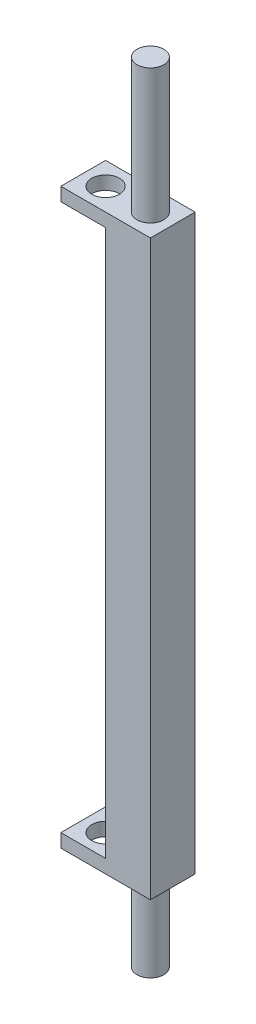
from build123d import *

# Parameters (mm, degrees)
SKETCH_2_W          = 10
SKETCH_2_H          = 5
EXTRUDE_1_DEPTH     = 1.5
SKETCH_3_R          = 1.55
CUT_EXTRUDE_1_DEPTH = 1.5
SKETCH_4_W          = 5
SKETCH_4_H          = 5
EXTRUDE_2_DEPTH     = 61
SKETCH_5_W          = 10
SKETCH_5_H          = 5
EXTRUDE_3_DEPTH     = 1.5
SKETCH_6_R          = 1.55
CUT_EXTRUDE_2_DEPTH = 1.5
SKETCH_7_R          = 1.5
EXTRUDE_4_DEPTH     = 15
EXTRUDE_START       = 9
SKETCH_11_R         = 1.5
EXTRUDE_5_DEPTH     = 9


with BuildPart() as part:
    # 草图2 → 凸台-拉伸1 (new body)
    with BuildSketch(Plane(origin=(0, 0, 0), x_dir=(1, 0, 0), z_dir=(0, 1, 0))):
        Rectangle(SKETCH_2_W, SKETCH_2_H)
    extrude(amount=EXTRUDE_1_DEPTH)

    # 草图3 → 切除-拉伸1 (cut)
    with BuildSketch(Plane.XZ):
        with Locations((-2.5, 0)):
            Circle(SKETCH_3_R)
    extrude(amount=-CUT_EXTRUDE_1_DEPTH, mode=Mode.SUBTRACT)

    # 草图4 → 凸台-拉伸2 (add)
    with BuildSketch(Plane.XZ):
        with Locations((2.5, 0)):
            Rectangle(SKETCH_4_W, SKETCH_4_H)
    extrude(amount=EXTRUDE_2_DEPTH)

    # 草图5 → 凸台-拉伸3 (add)
    with BuildSketch(Plane.XZ.offset(61)):
        Rectangle(SKETCH_5_W, SKETCH_5_H)
    extrude(amount=EXTRUDE_3_DEPTH)

    # 草图6 → 切除-拉伸2 (cut)
    with BuildSketch(Plane.XZ.offset(62.5)):
        with Locations((-2.5, 0)):
            Circle(SKETCH_6_R)
    extrude(amount=-CUT_EXTRUDE_2_DEPTH, mode=Mode.SUBTRACT)

    # 草图7 → 凸台-拉伸4 (add)
    with BuildSketch(Plane(origin=(0, 1.5, 0), x_dir=(1, 0, 0), z_dir=(0, 1, 0))):
        with Locations((2.5, 0)):
            Circle(SKETCH_7_R)
    extrude(amount=EXTRUDE_4_DEPTH)

    # 草图11 → 凸台-拉伸5 (add)
    with BuildSketch(Plane.XZ.offset(62.5).offset(EXTRUDE_START)):
        with Locations((2.5, 0)):
            Circle(SKETCH_11_R)
    extrude(amount=-EXTRUDE_5_DEPTH)


solid = part.part
